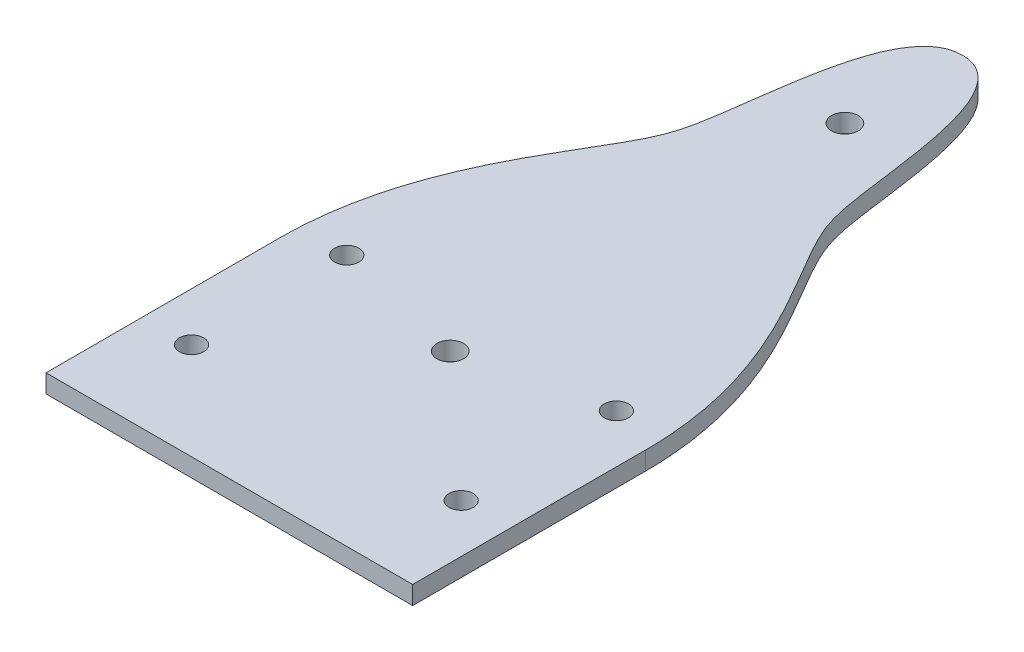
from build123d import *

# Parameters (mm, degrees)
SKETCH1_W           = 60
SKETCH1_H           = 120
BOSS_EXTRUDE1_DEPTH = 3
SKETCH2_R           = 2.185
CUT_EXTRUDE1_DEPTH  = 68.149087857
CUT_EXTRUDE2_DEPTH  = 68.149087857
SKETCH4_R           = 1.984375
CUT_EXTRUDE3_DEPTH  = 68.149087995


with BuildPart() as part:
    # Sketch1 → Boss-Extrude1 (new body)
    with BuildSketch(Plane(origin=(0, 0, 0), x_dir=(1, 0, 0), z_dir=(0, 1, 0))):
        Rectangle(SKETCH1_W, SKETCH1_H)
    extrude(amount=BOSS_EXTRUDE1_DEPTH)

    # Sketch2 → Cut-Extrude1 (cut, through all)
    with BuildSketch(Plane(origin=(0, 3, 0), x_dir=(1, 0, 0), z_dir=(0, 1, 0))):
        with Locations((0, -23.856)):
            Circle(SKETCH2_R)
        with Locations((0, 40.736)):
            Circle(SKETCH2_R)
    extrude(amount=-CUT_EXTRUDE1_DEPTH, mode=Mode.SUBTRACT)

    # Sketch3 → Cut-Extrude2 (cut, through all)
    with BuildSketch(Plane(origin=(0, 3, 0), x_dir=(1, 0, 0), z_dir=(0, 1, 0))):
        with BuildLine():
            Line((30, -21.9), (30, 60))
            Line((30, 60), (0, 60))
            add(Edge.make_bspline(
                [(0, 60), (9.906897678, 60), (10.116738443, 32.51403174), (16.216386116, 16.253262419), (30, -0.686105814), (30, -21.9)],
                knots=[0, 0, 0, 0, 0.419462523, 0.519462523, 1, 1, 1, 1], degree=3))
        make_face()
    cut_extrude2 = extrude(amount=-CUT_EXTRUDE2_DEPTH, mode=Mode.SUBTRACT)

    # Mirror1: Cut-Extrude2 across plane
    add(cut_extrude2.mirror(Plane(origin=(0, 0, 0), x_dir=(0, 0, 1), z_dir=(1, 0, 0))), mode=Mode.SUBTRACT)

    # Sketch4 → Cut-Extrude3 (cut, through all)
    with BuildSketch(Plane(origin=(0, 3, 0), x_dir=(1, 0, 0), z_dir=(0, 1, 0))):
        with Locations((22.0625, -44.125)):
            Circle(SKETCH4_R)
        with Locations((22.0625, -18.725)):
            Circle(SKETCH4_R)
        with Locations((-22.0625, -18.725)):
            Circle(SKETCH4_R)
        with Locations((-22.0625, -44.125)):
            Circle(SKETCH4_R)
    extrude(amount=-CUT_EXTRUDE3_DEPTH, mode=Mode.SUBTRACT)


solid = part.part
